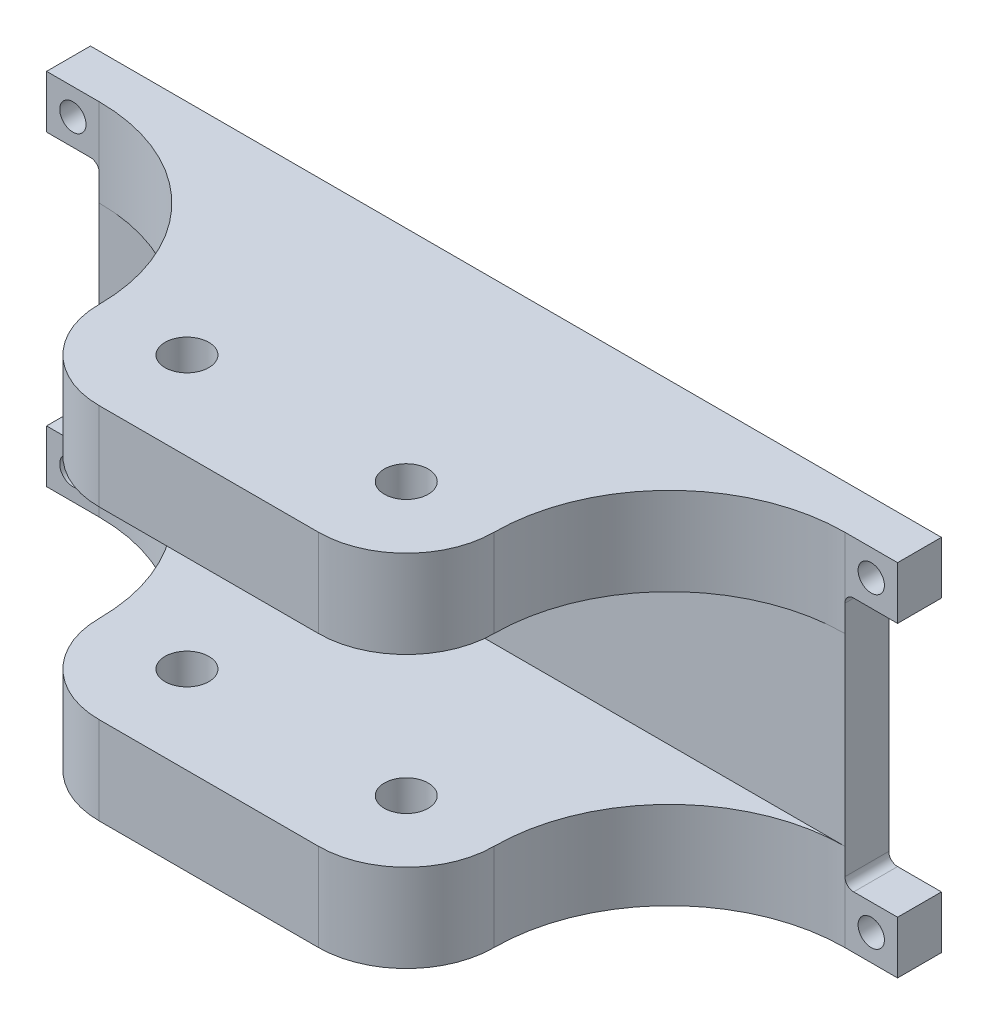
from build123d import *

# Parameters (mm, degrees)
SKETCH1_W            = 85
SKETCH1_H            = 41
BOSS_EXTRUDE1_DEPTH  = 5
SKETCH3_W            = 45
SKETCH3_H            = 10
BOSS_EXTRUDE3_DEPTH  = 30
SKETCH4_W            = 6
SKETCH4_H            = 6
SKETCH4_R            = 1.5
BOSS_EXTRUDE4_DEPTH  = 5
LPATTERN1_COUNT      = 2
LPATTERN1_PITCH      = 35
LPATTERN1_COUNT_DIR2 = 2
LPATTERN1_PITCH_DIR2 = 91
FILLET1_R            = 20
SKETCH5_R            = 2.5
CUT_EXTRUDE1_DEPTH   = 41
FILLET2_R            = 1
FILLET3_R            = 10


with BuildPart() as part:
    # Sketch1 → Boss-Extrude1 (new body)
    with BuildSketch(Plane.XY):
        with Locations((42.5, 20.5)):
            Rectangle(SKETCH1_W, SKETCH1_H)
    extrude(amount=BOSS_EXTRUDE1_DEPTH)

    # Sketch3 → Boss-Extrude3 (add)
    with BuildSketch(Plane.XY.offset(5)):
        with Locations((42.5, 36)):
            Rectangle(SKETCH3_W, SKETCH3_H)
        with Locations((42.5, 5)):
            Rectangle(SKETCH3_W, SKETCH3_H)
    extrude(amount=BOSS_EXTRUDE3_DEPTH)

    # Sketch4 → Boss-Extrude4 (add)
    with BuildSketch(Plane.XY.offset(5)):
        with Locations((-3, 38)):
            Rectangle(SKETCH4_W, SKETCH4_H)
        with Locations((-3, 38)):
            Circle(SKETCH4_R, mode=Mode.SUBTRACT)
    boss_extrude4 = extrude(amount=-BOSS_EXTRUDE4_DEPTH)

    # LPattern1: Boss-Extrude4 2 × 2
    with Locations(*[(j * LPATTERN1_PITCH_DIR2, -i * LPATTERN1_PITCH, 0) for i in range(LPATTERN1_COUNT) for j in range(LPATTERN1_COUNT_DIR2) if (i, j) != (0, 0)]):
        add(boss_extrude4)

    # Fillet1
    fillet1_edges = [part.edges().sort_by_distance(p)[0] for p in [
        (20, 36, 5),
        (65, 36, 5),
        (20, 5, 5),
        (65, 5, 5),
    ]]
    fillet(fillet1_edges, radius=FILLET1_R - 0.0001)  # a hair under: the kernel refuses the full size

    # Sketch5 → Cut-Extrude1 (cut)
    with BuildSketch(Plane(origin=(0, 41, 0), x_dir=(1, 0, 0), z_dir=(0, 1, 0))):
        with Locations(Location((30, -25, 0), (0, 0, 270))):
            Circle(SKETCH5_R)
        with Locations(Location((55, -25, 0), (0, 0, 270))):
            Circle(SKETCH5_R)
    extrude(amount=-CUT_EXTRUDE1_DEPTH, mode=Mode.SUBTRACT)

    # Fillet2
    fillet2_edges = [part.edges().sort_by_distance(p)[0] for p in [
        (0, 35, 2.5),
        (85, 35, 2.5),
        (0, 6, 2.5),
        (85, 6, 2.5),
    ]]
    fillet(fillet2_edges, radius=FILLET2_R)

    # Fillet3
    fillet3_edges = [part.edges().sort_by_distance(p)[0] for p in [
        (65, 5, 35),
        (20, 5, 35),
        (65, 36, 35),
        (20, 36, 35),
    ]]
    fillet(fillet3_edges, radius=FILLET3_R)


solid = part.part
